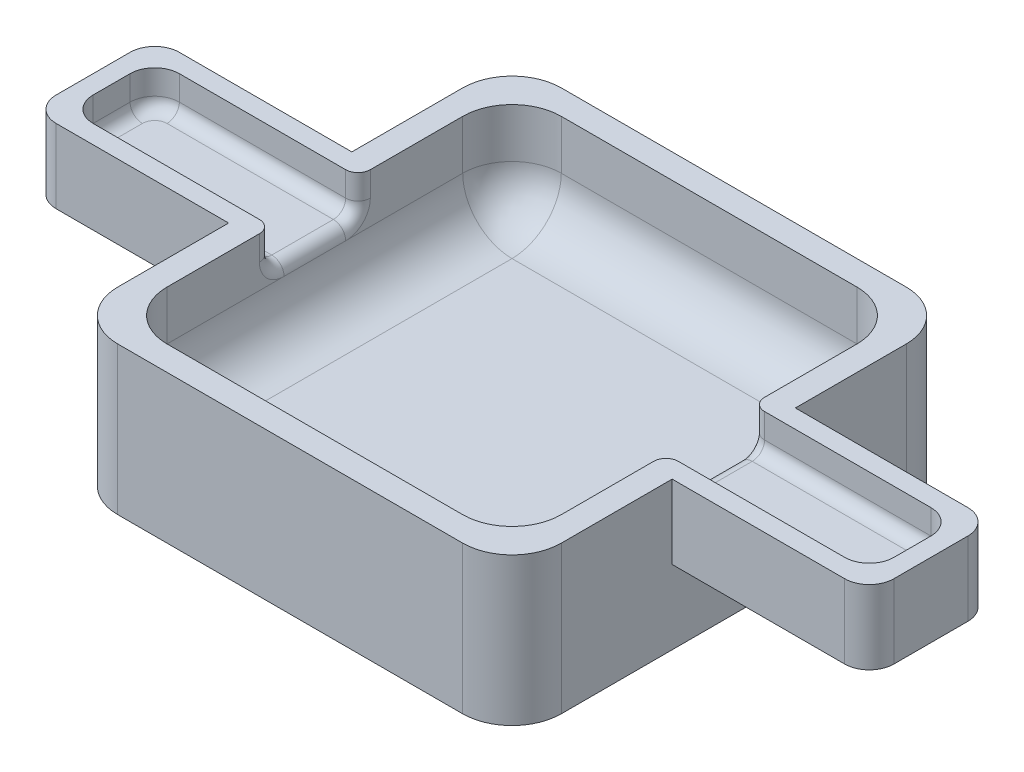
from build123d import *

# Parameters (mm, degrees)
BOSS_EXTRUDE1_DEPTH = 2
BOSS_EXTRUDE2_DEPTH = 4
FILLET1_R           = 2
BOSS_EXTRUDE3_DEPTH = 3
CUT_EXTRUDE1_DEPTH  = 1.5
FILLET2_R           = 0.5


with BuildPart() as part:
    # Sketch1 → Boss-Extrude1 (new body)
    with BuildSketch(Plane(origin=(0, 0, 0), x_dir=(1, 0, 0), z_dir=(0, 1, 0))):
        with BuildLine():
            Line((-7, -9), (7, -9))
            ThreePointArc((7, -9), (8.414213562, -8.414213562), (9, -7))
            Line((9, -7), (9, 7))
            ThreePointArc((9, 7), (8.414213562, 8.414213562), (7, 9))
            Line((7, 9), (-7, 9))
            ThreePointArc((-7, 9), (-8.414213562, 8.414213562), (-9, 7))
            Line((-9, 7), (-9, -7))
            ThreePointArc((-9, -7), (-8.414213562, -8.414213562), (-7, -9))
        make_face()
    extrude(amount=BOSS_EXTRUDE1_DEPTH)

    # Sketch2 → Boss-Extrude2 (add)
    with BuildSketch(Plane(origin=(0, 2, 0), x_dir=(1, 0, 0), z_dir=(0, 1, 0))):
        with BuildLine():
            Line((-7, -9), (7, -9))
            ThreePointArc((7, -9), (8.414213562, -8.414213562), (9, -7))
            Line((9, -7), (9, 7))
            ThreePointArc((9, 7), (8.414213562, 8.414213562), (7, 9))
            Line((7, 9), (-7, 9))
            ThreePointArc((-7, 9), (-8.414213562, 8.414213562), (-9, 7))
            Line((-9, 7), (-9, -7))
            ThreePointArc((-9, -7), (-8.414213562, -8.414213562), (-7, -9))
        make_face()
        with BuildLine():
            Line((-6, -8), (6, -8))
            ThreePointArc((6, -8), (7.414213562, -7.414213562), (8, -6))
            Line((8, -6), (8, 6))
            ThreePointArc((8, 6), (7.414213562, 7.414213562), (6, 8))
            Line((6, 8), (-6, 8))
            ThreePointArc((-6, 8), (-7.414213562, 7.414213562), (-8, 6))
            Line((-8, 6), (-8, -6))
            ThreePointArc((-8, -6), (-7.414213562, -7.414213562), (-6, -8))
        make_face(mode=Mode.SUBTRACT)
    extrude(amount=BOSS_EXTRUDE2_DEPTH)

    # Fillet1
    fillet1_edges = [part.edges().sort_by_distance(p)[0] for p in [
        (-7.414213562, 2, 7.414213562),
        (0, 2, 8),
        (7.414213562, 2, 7.414213562),
        (8, 2, 0),
        (7.414213562, 2, -7.414213562),
        (0, 2, -8),
        (-7.414213562, 2, -7.414213562),
        (-8, 2, 0),
    ]]
    fillet(fillet1_edges, radius=FILLET1_R)

    # Sketch3 → Boss-Extrude3 (add)
    with BuildSketch(Plane(origin=(0, 6, 0), x_dir=(1, 0, 0), z_dir=(0, 1, 0))):
        with BuildLine():
            Line((-9, 2.5), (-16, 2.5))
            ThreePointArc((-16, 2.5), (-16.707106781, 2.207106781), (-17, 1.5))
            Line((-17, 1.5), (-17, -1.5))
            ThreePointArc((-17, -1.5), (-16.707106781, -2.207106781), (-16, -2.5))
            Line((-16, -2.5), (-9, -2.5))
            Line((-9, -2.5), (-9, 2.5))
        make_face()
        with BuildLine():
            Line((9, 2.5), (16, 2.5))
            ThreePointArc((16, 2.5), (16.707106781, 2.207106781), (17, 1.5))
            Line((17, 1.5), (17, -1.5))
            ThreePointArc((17, -1.5), (16.707106781, -2.207106781), (16, -2.5))
            Line((16, -2.5), (9, -2.5))
            Line((9, -2.5), (9, 2.5))
        make_face()
    extrude(amount=-BOSS_EXTRUDE3_DEPTH)

    # Sketch4 → Cut-Extrude1 (cut)
    with BuildSketch(Plane(origin=(0, 6, 0), x_dir=(1, 0, 0), z_dir=(0, 1, 0))):
        with BuildLine():
            Line((-8, 1.75), (-15.25, 1.75))
            ThreePointArc((-15.25, 1.75), (-15.957106781, 1.457106781), (-16.25, 0.75))
            Line((-16.25, 0.75), (-16.25, -0.75))
            ThreePointArc((-16.25, -0.75), (-15.957106781, -1.457106781), (-15.25, -1.75))
            Line((-15.25, -1.75), (-8, -1.75))
            Line((-8, -1.75), (-8, 1.75))
        make_face()
        with BuildLine():
            Line((8, 1.75), (15.25, 1.75))
            ThreePointArc((15.25, 1.75), (15.957106781, 1.457106781), (16.25, 0.75))
            Line((16.25, 0.75), (16.25, -0.75))
            ThreePointArc((16.25, -0.75), (15.957106781, -1.457106781), (15.25, -1.75))
            Line((15.25, -1.75), (8, -1.75))
            Line((8, -1.75), (8, 1.75))
        make_face()
    extrude(amount=-CUT_EXTRUDE1_DEPTH, mode=Mode.SUBTRACT)

    # Fillet2
    fillet2_edges = [part.edges().sort_by_distance(p)[0] for p in [
        (-8, 4.5, 0),
        (-8, 5.25, -1.75),
        (-11.625, 4.5, 1.75),
        (-8, 5.25, 1.75),
        (-15.957106781, 4.5, 1.457106781),
        (-16.25, 4.5, 0),
        (-15.957106781, 4.5, -1.457106781),
        (-11.625, 4.5, -1.75),
        (8, 4.5, 0),
        (8, 5.25, 1.75),
        (11.625, 4.5, -1.75),
        (8, 5.25, -1.75),
        (15.957106781, 4.5, -1.457106781),
        (16.25, 4.5, 0),
        (15.957106781, 4.5, 1.457106781),
        (11.625, 4.5, 1.75),
    ]]
    fillet(fillet2_edges, radius=FILLET2_R - 0.0001)  # a hair under: the kernel refuses the full size


solid = part.part
